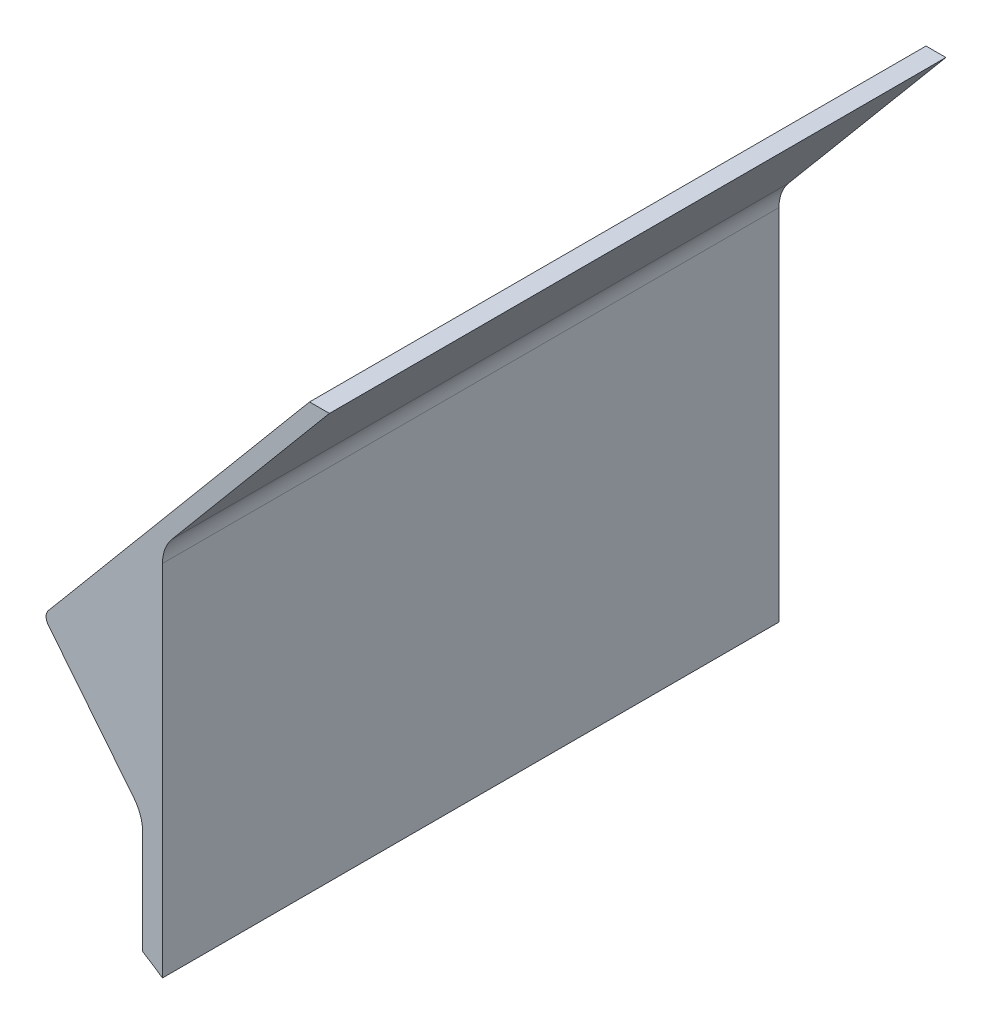
from build123d import *

# Parameters (mm, degrees)
FUNNEL_RIGHT_SIDE_DEPTH = 155
FILLET2_R               = 10
FILLET3_R               = 2.5


with BuildPart() as part:
    # Sketch1 → Funnel - Right Side (new body)
    with BuildSketch(Plane.XY):
        with BuildLine():
            Line((0, 0), (0, 93.9))
            Line((0, 93.9), (41.974030913, 143.922702136))
            Line((41.974030913, 143.922702136), (36.974030913, 143.922702136))
            Line((36.974030913, 143.922702136), (-30, 64.106160185))
            Line((-30, 64.106160185), (-5, 32.881170193))
            Line((-5, 32.881170193), (-5, 3.266851564))
            ThreePointArc((-5, 3.266851564), (-2.484755158, 1.656758403), (0, 0))
        make_face()
    extrude(amount=FUNNEL_RIGHT_SIDE_DEPTH)

    # Fillet2
    fillet2_edges = [part.edges().sort_by_distance(p)[0] for p in [
        (0, 93.9, 77.5),
        (-5, 32.881170193, 77.5),
    ]]
    fillet(fillet2_edges, radius=FILLET2_R)

    # Fillet3
    fillet3_edges = [part.edges().sort_by_distance(p)[0] for p in [
        (-30, 64.106160185, 77.5),
    ]]
    fillet(fillet3_edges, radius=FILLET3_R)


solid = part.part
